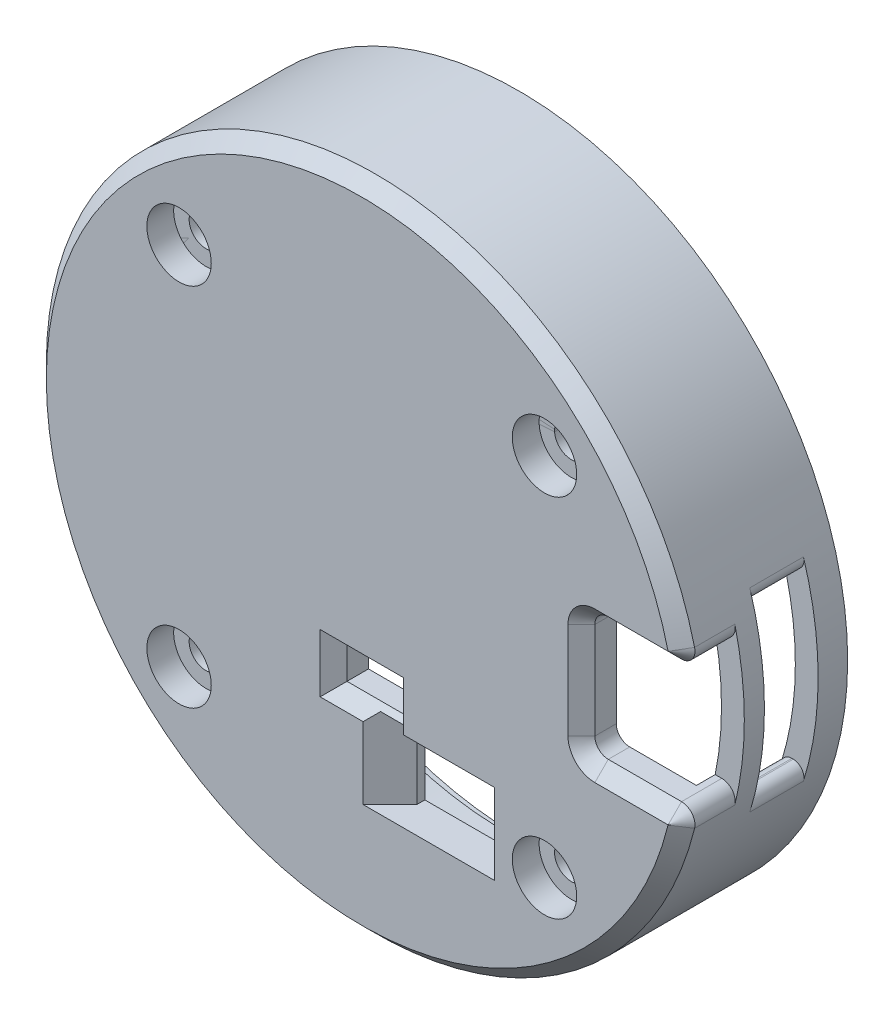
from build123d import *

# Parameters (mm, degrees)
SKETCH_2_R          = 24.5
SKETCH_2_R_2        = 23.6
EXTRUDE_3_DEPTH     = 11.7
SKETCH_2_5_R        = 23.6
SKETCH_2_5_R_2      = 22.8
EXTRUDE_4_DEPTH     = 10.7
SKETCH_2_6_R        = 2.7
SKETCH_2_6_R_2      = 2.3
SKETCH_2_6_W        = 5.8
SKETCH_2_6_H        = 6
SKETCH_2_6_W_2      = 4.2
SKETCH_2_6_H_2      = 2.343935591
EXTRUDE_5_DEPTH     = 2.6
SKETCH_2_7_R        = 2.4
SKETCH_2_7_R_2      = 1.25
EXTRUDE_6_DEPTH     = 4
EXTRUDE_6_2_DEPTH   = 4
EXTRUDE_6_3_DEPTH   = 4
EXTRUDE_6_4_DEPTH   = 4
SKETCH_2_20_R       = 2.3
EXTRUDE_10_DEPTH    = 1.5
SKETCH_2_9_R        = 2.7
SKETCH_2_9_R_2      = 1.25
SKETCH_2_9_R_3      = 2.4
EXTRUDE_7_DEPTH     = 4
CUT_EXTRUDE_2_DEPTH = 9.5
SKETCH_2_18_R       = 2.4
SKETCH_2_18_R_2     = 1.25
CUT_EXTRUDE_3_DEPTH = 2
SKETCH_2_14_R       = 24.5
SKETCH_2_14_R_2     = 22.8
EXTRUDE_9_DEPTH     = 5.5
CUT_EXTRUDE_4_DEPTH = 4
FILLET_2_R          = 0.8
FILLET_3_R          = 0.8
FILLET_4_R          = 0.8
FILLET_5_R          = 0.8
CHAMFER_1_SIZE      = 2
FILLET_6_R          = 1
CHAMFER_5_SIZE      = 1


with BuildPart() as part:
    # 草图2 → 凸台-拉伸3 (new body)
    with BuildSketch(Plane.XY):
        Circle(SKETCH_2_R)
        Circle(SKETCH_2_R_2, mode=Mode.SUBTRACT)
    extrude(amount=-EXTRUDE_3_DEPTH)

    # 草图2<5> → 凸台-拉伸4 (add)
    with BuildSketch(Plane.XY):
        Circle(SKETCH_2_5_R)
        Circle(SKETCH_2_5_R_2, mode=Mode.SUBTRACT)
    extrude(amount=-EXTRUDE_4_DEPTH)

    # 草图2<6> → 凸台-拉伸5 (add)
    with BuildSketch(Plane.XY):
        with BuildLine():
            Line((16.364288895, 4.6), (22.331144171, 4.6))
            ThreePointArc((22.331144171, 4.6), (22.150438226, 5.403525366), (21.940829519, 6.2))
            ThreePointArc((21.940829519, 6.2), (-22.8, 0), (21.940829519, -6.2))
            ThreePointArc((21.940829519, -6.2), (22.150438226, -5.403525366), (22.331144171, -4.6))
            Line((22.331144171, -4.6), (16.364288895, -4.6))
            Line((16.364288895, -4.6), (16.364288895, 4.6))
        make_face()
        with Locations((-13.611805538, -13.611805538)):
            Circle(SKETCH_2_6_R, mode=Mode.SUBTRACT)
        with Locations((-3.326426064, -13.341566236)):
            Circle(SKETCH_2_6_R_2, mode=Mode.SUBTRACT)
        with Locations((5, -12.65)):
            Rectangle(SKETCH_2_6_W, SKETCH_2_6_H, mode=Mode.SUBTRACT)
        with Locations((13.611805538, -13.611805538)):
            Circle(SKETCH_2_6_R, mode=Mode.SUBTRACT)
        with Locations((0, -8.128032205)):
            Rectangle(SKETCH_2_6_W_2, SKETCH_2_6_H_2, mode=Mode.SUBTRACT)
        with Locations((-9.020811649, 10.377256728)):
            Circle(SKETCH_2_6_R_2, mode=Mode.SUBTRACT)
        with Locations((-13.611805538, 13.611805538)):
            Circle(SKETCH_2_6_R, mode=Mode.SUBTRACT)
        with Locations((9.020811649, 10.377256728)):
            Circle(SKETCH_2_6_R_2, mode=Mode.SUBTRACT)
        with Locations((13.611805538, 13.611805538)):
            Circle(SKETCH_2_6_R, mode=Mode.SUBTRACT)
    extrude(amount=-EXTRUDE_5_DEPTH)

    # 草图2<20> → 凸台-拉伸10 (add)
    with BuildSketch(Plane.XY):
        with Locations((-9.020811649, 10.377256728)):
            Circle(SKETCH_2_20_R)
        with Locations((9.020811649, 10.377256728)):
            Circle(SKETCH_2_20_R)
        with Locations((-3.326426064, -13.341566236)):
            Circle(SKETCH_2_20_R)
    extrude(amount=-EXTRUDE_10_DEPTH)

    # 草图2<9> → 凸台-拉伸7 (add)
    # profile 1 of 8: a face of its own
    with BuildSketch(Plane.XY):
        with Locations((-13.611805538, 13.611805538)):
            Circle(SKETCH_2_9_R)
        with Locations((-13.611805538, 13.611805538)):
            Circle(SKETCH_2_9_R_2, mode=Mode.SUBTRACT)
    # profile 2 of 8: a face of its own
    with BuildSketch(Plane.XY):
        with Locations((13.611805538, 13.611805538)):
            Circle(SKETCH_2_9_R)
        with Locations((13.611805538, 13.611805538)):
            Circle(SKETCH_2_9_R_2, mode=Mode.SUBTRACT)
    # profile 3 of 8: a face of its own
    with BuildSketch(Plane.XY):
        with Locations((-13.611805538, 13.611805538)):
            Circle(SKETCH_2_9_R)
        with Locations((-13.611805538, 13.611805538)):
            Circle(SKETCH_2_9_R_3, mode=Mode.SUBTRACT)
    # profile 4 of 8: a face of its own
    with BuildSketch(Plane.XY):
        with Locations((13.611805538, 13.611805538)):
            Circle(SKETCH_2_9_R)
        with Locations((13.611805538, 13.611805538)):
            Circle(SKETCH_2_9_R_3, mode=Mode.SUBTRACT)
    # profile 5 of 8: a face of its own
    with BuildSketch(Plane.XY):
        with Locations((13.611805538, -13.611805538)):
            Circle(SKETCH_2_9_R)
        with Locations((13.611805538, -13.611805538)):
            Circle(SKETCH_2_9_R_3, mode=Mode.SUBTRACT)
    # profile 6 of 8: a face of its own
    with BuildSketch(Plane.XY):
        with Locations((-13.611805538, -13.611805538)):
            Circle(SKETCH_2_9_R)
        with Locations((-13.611805538, -13.611805538)):
            Circle(SKETCH_2_9_R_3, mode=Mode.SUBTRACT)
    # profile 7 of 8: a face of its own
    with BuildSketch(Plane.XY):
        with Locations((-13.611805538, -13.611805538)):
            Circle(SKETCH_2_9_R_3)
        with Locations((-13.611805538, -13.611805538)):
            Circle(SKETCH_2_9_R_2, mode=Mode.SUBTRACT)
    # profile 8 of 8: a face of its own
    with BuildSketch(Plane.XY):
        with Locations((13.611805538, -13.611805538)):
            Circle(SKETCH_2_9_R_3)
        with Locations((13.611805538, -13.611805538)):
            Circle(SKETCH_2_9_R_2, mode=Mode.SUBTRACT)
    extrude(amount=-EXTRUDE_7_DEPTH)

    # 草图2<13> → 切除-拉伸2 (cut)
    with BuildSketch(Plane.XY):
        with BuildLine():
            Line((23.70253151, 6.2), (21.940829519, 6.2))
            ThreePointArc((21.940829519, 6.2), (22.8, 0), (21.940829519, -6.2))
            Line((21.940829519, -6.2), (23.70253151, -6.2))
            ThreePointArc((23.70253151, -6.2), (24.5, 0), (23.70253151, 6.2))
        make_face()
    extrude(amount=-CUT_EXTRUDE_2_DEPTH, mode=Mode.SUBTRACT)


with BuildPart() as body_2:
    # 草图2<7> → 凸台-拉伸6 (new body)
    with BuildSketch(Plane.XY):
        with Locations((13.611805538, 13.611805538)):
            Circle(SKETCH_2_7_R)
        with Locations((13.611805538, 13.611805538)):
            Circle(SKETCH_2_7_R_2, mode=Mode.SUBTRACT)
    extrude(amount=-EXTRUDE_6_DEPTH)


with BuildPart() as body_3:
    # 草图2<7> → Extrude 6 2 (new body)
    with BuildSketch(Plane.XY):
        with Locations((-13.611805538, 13.611805538)):
            Circle(SKETCH_2_7_R)
        with Locations((-13.611805538, 13.611805538)):
            Circle(SKETCH_2_7_R_2, mode=Mode.SUBTRACT)
    extrude(amount=-EXTRUDE_6_2_DEPTH)


with BuildPart() as body_4:
    # 草图2<7> → Extrude 6 3 (new body)
    with BuildSketch(Plane.XY):
        with Locations((13.611805538, -13.611805538)):
            Circle(SKETCH_2_7_R)
        with Locations((13.611805538, -13.611805538)):
            Circle(SKETCH_2_7_R_2, mode=Mode.SUBTRACT)
    extrude(amount=-EXTRUDE_6_3_DEPTH)


with BuildPart() as body_5:
    # 草图2<7> → Extrude 6 4 (new body)
    with BuildSketch(Plane.XY):
        with Locations((-13.611805538, -13.611805538)):
            Circle(SKETCH_2_7_R)
        with Locations((-13.611805538, -13.611805538)):
            Circle(SKETCH_2_7_R_2, mode=Mode.SUBTRACT)
    extrude(amount=-EXTRUDE_6_4_DEPTH)


with BuildPart() as cut_extrude_3_tool:
    # 草图2<18> → 切除-拉伸3 (new body)
    # profile 1 of 4: a face of its own
    with BuildSketch(Plane.XY):
        with Locations((13.611805538, 13.611805538)):
            Circle(SKETCH_2_18_R)
        with Locations((13.611805538, 13.611805538)):
            Circle(SKETCH_2_18_R_2, mode=Mode.SUBTRACT)
    # profile 2 of 4: a face of its own
    with BuildSketch(Plane.XY):
        with Locations((13.611805538, -13.611805538)):
            Circle(SKETCH_2_18_R)
        with Locations((13.611805538, -13.611805538)):
            Circle(SKETCH_2_18_R_2, mode=Mode.SUBTRACT)
    # profile 3 of 4: a face of its own
    with BuildSketch(Plane.XY):
        with Locations((-13.611805538, -13.611805538)):
            Circle(SKETCH_2_18_R)
        with Locations((-13.611805538, -13.611805538)):
            Circle(SKETCH_2_18_R_2, mode=Mode.SUBTRACT)
    # profile 4 of 4: a face of its own
    with BuildSketch(Plane.XY):
        with Locations((-13.611805538, 13.611805538)):
            Circle(SKETCH_2_18_R)
        with Locations((-13.611805538, 13.611805538)):
            Circle(SKETCH_2_18_R_2, mode=Mode.SUBTRACT)
    extrude(amount=-CUT_EXTRUDE_3_DEPTH)


with BuildPart() as part_1:
    add(part.part)

    # 切除-拉伸3: cut by cut_extrude_3_tool
    add(cut_extrude_3_tool.part, mode=Mode.SUBTRACT)

    # 草图2<14> → 凸台-拉伸9 (add)
    with BuildSketch(Plane.XY):
        Circle(SKETCH_2_14_R)
        Circle(SKETCH_2_14_R_2, mode=Mode.SUBTRACT)
    extrude(amount=-EXTRUDE_9_DEPTH)

    # 草图2<19> → 切除-拉伸4 (cut)
    with BuildSketch(Plane.XY):
        with BuildLine():
            ThreePointArc((23.6, 0), (23.486565903, 2.311108411), (23.14735406, 4.6))
            Line((23.14735406, 4.6), (22.331144171, 4.6))
            ThreePointArc((22.331144171, 4.6), (22.682483188, 2.311916185), (22.8, 0))
            ThreePointArc((22.8, 0), (22.682483188, -2.311916185), (22.331144171, -4.6))
            Line((22.331144171, -4.6), (23.14735406, -4.6))
            ThreePointArc((23.14735406, -4.6), (23.486565903, -2.311108411), (23.6, 0))
        make_face()
        with BuildLine():
            ThreePointArc((24.5, 0), (24.390828993, 2.310294579), (24.064288895, 4.6))
            Line((24.064288895, 4.6), (23.14735406, 4.6))
            ThreePointArc((23.14735406, 4.6), (23.486565903, 2.311108411), (23.6, 0))
            ThreePointArc((23.6, 0), (23.486565903, -2.311108411), (23.14735406, -4.6))
            Line((23.14735406, -4.6), (24.064288895, -4.6))
            ThreePointArc((24.064288895, -4.6), (24.390828993, -2.310294579), (24.5, 0))
        make_face()
    extrude(amount=-CUT_EXTRUDE_4_DEPTH, mode=Mode.SUBTRACT)

    # 圆角2
    fillet_2_edges = [part_1.edges().sort_by_distance(p)[0] for p in [
        (23.70253151, 6.2, -7.5),
    ]]
    fillet(fillet_2_edges, radius=FILLET_2_R)

    # 圆角3
    fillet_3_edges = [part_1.edges().sort_by_distance(p)[0] for p in [
        (23.70253151, -6.2, -7.5),
    ]]
    fillet(fillet_3_edges, radius=FILLET_3_R)

    # 圆角4
    fillet_4_edges = [part_1.edges().sort_by_distance(p)[0] for p in [
        (21.940829519, -6.2, -7.5),
    ]]
    fillet(fillet_4_edges, radius=FILLET_4_R)

    # 圆角5
    fillet_5_edges = [part_1.edges().sort_by_distance(p)[0] for p in [
        (21.940829519, 6.2, -7.5),
    ]]
    fillet(fillet_5_edges, radius=FILLET_5_R)

    # 倒角1
    chamfer_1_edges = [part_1.edges().sort_by_distance(p)[0] for p in [
        (2.1, -12.65, 0),
        (7.9, -12.65, 0),
    ]]
    chamfer(chamfer_1_edges, length=CHAMFER_1_SIZE)

    # 倒角4
    # the kernel refuses this chamfer: 1 mm, written as the material it takes off along each edge
    with BuildSketch(Plane(origin=(-2.1, -6.956064409, 0), x_dir=(0, 0.9996219169112968, 0.027495876610586365), z_dir=(1, 0, 0)), Plane(origin=(2.1, -9.3, 0), x_dir=(0, -0.9996219169112968, 0.02749587661058639), z_dir=(-1, 0, 0))) as chamfer_4_piece_1:
        with BuildLine():
            Line((1.028673195, 0), (-0.056547155, -1.027117794))
            Line((-0.056547155, -1.027117794), (-0.076539593, -1.026567876))
            ThreePointArc((-0.076539593, -1.026567876), (-0.034129227, -0.51339783), (-0.019992438, 0.000549918))
            Line((-0.019992438, 0.000549918), (0.000549918, 0.019992438))
            ThreePointArc((0.000549918, 0.019992438), (0.514497665, 0.00585565), (1.029223113, 0.019992438))
            Line((1.029223113, 0.019992438), (1.028673195, 0))
        make_face()
    extrude(amount=4.2, mode=Mode.SUBTRACT)
    with BuildSketch(Plane(origin=(-2.1, -9.3, 0), x_dir=(-0.9996219169112968, 0, 0.027495876610586365), z_dir=(0, 1, 0)), Plane(origin=(2.1, -6.956064409, 0), x_dir=(0.9996219169112968, 0, 0.027495876610586365), z_dir=(0, -1, 0))) as chamfer_4_piece_2:
        with BuildLine():
            Line((1.028673195, 0), (-0.056547155, -1.027117794))
            Line((-0.056547155, -1.027117794), (-0.076539593, -1.026567876))
            ThreePointArc((-0.076539593, -1.026567876), (-0.034129227, -0.51339783), (-0.019992438, 0.000549918))
            Line((-0.019992438, 0.000549918), (0.000549918, 0.019992438))
            ThreePointArc((0.000549918, 0.019992438), (0.514497665, 0.00585565), (1.029223113, 0.019992438))
            Line((1.029223113, 0.019992438), (1.028673195, 0))
        make_face()
    extrude(amount=2.343935591, mode=Mode.SUBTRACT)
    with BuildSketch(Plane(origin=(-2.1, -9.3, 0), x_dir=(-0.9996219169112968, 0, 0.027495876610586365), z_dir=(0, 1, 0))) as chamfer_4_piece_3a_section:
        with BuildLine():
            Line((1.028673195, 0), (-0.056547155, -1.027117794))
            Line((-0.056547155, -1.027117794), (-0.076539593, -1.026567876))
            ThreePointArc((-0.076539593, -1.026567876), (-0.034129227, -0.51339783), (-0.019992438, 0.000549918))
            Line((-0.019992438, 0.000549918), (0.000549918, 0.019992438))
            ThreePointArc((0.000549918, 0.019992438), (0.514497665, 0.00585565), (1.029223113, 0.019992438))
            Line((1.029223113, 0.019992438), (1.028673195, 0))
        make_face()
    chamfer_4_piece_3a = extrude(amount=4.915618579, mode=Mode.PRIVATE)
    chamfer_4_piece_3a = split(chamfer_4_piece_3a, bisect_by=Plane(origin=(-2.429793627, -6.956064409, -0.329793627), z_dir=(0, 1, 0)), keep=Keep.TOP, mode=Mode.PRIVATE)
    with BuildSketch(Plane(origin=(-4.671682988, -6.956064409, 0), x_dir=(0, 0.9996219169112968, 0.027495876610586365), z_dir=(1, 0, 0))) as chamfer_4_piece_3b_section:
        with BuildLine():
            Line((1.028673195, 0), (-0.056547155, -1.027117794))
            Line((-0.056547155, -1.027117794), (-0.076539593, -1.026567876))
            ThreePointArc((-0.076539593, -1.026567876), (-0.034129227, -0.51339783), (-0.019992438, 0.000549918))
            Line((-0.019992438, 0.000549918), (0.000549918, 0.019992438))
            ThreePointArc((0.000549918, 0.019992438), (0.514497665, 0.00585565), (1.029223113, 0.019992438))
            Line((1.029223113, 0.019992438), (1.028673195, 0))
        make_face()
    chamfer_4_piece_3b = extrude(amount=6.771682988, mode=Mode.PRIVATE)
    chamfer_4_piece_3b = split(chamfer_4_piece_3b, bisect_by=Plane(origin=(-2.1, -6.626270782, -0.329793627), z_dir=(-1, 0, 0)), keep=Keep.TOP, mode=Mode.PRIVATE)
    chamfer_4_piece_3 = chamfer_4_piece_3a & chamfer_4_piece_3b
    add(chamfer_4_piece_3, mode=Mode.SUBTRACT)
    with BuildSketch(Plane(origin=(-2.1, -6.956064409, 0), x_dir=(0, 0.9996219169112968, 0.027495876610586365), z_dir=(1, 0, 0))) as chamfer_4_piece_4a_section:
        with BuildLine():
            Line((1.028673195, 0), (-0.056547155, -1.027117794))
            Line((-0.056547155, -1.027117794), (-0.076539593, -1.026567876))
            ThreePointArc((-0.076539593, -1.026567876), (-0.034129227, -0.51339783), (-0.019992438, 0.000549918))
            Line((-0.019992438, 0.000549918), (0.000549918, 0.019992438))
            ThreePointArc((0.000549918, 0.019992438), (0.514497665, 0.00585565), (1.029223113, 0.019992438))
            Line((1.029223113, 0.019992438), (1.028673195, 0))
        make_face()
    chamfer_4_piece_4a = extrude(amount=6.771682988, mode=Mode.PRIVATE)
    chamfer_4_piece_4a = split(chamfer_4_piece_4a, bisect_by=Plane(origin=(2.1, -6.626270782, -0.329793627), z_dir=(1, 0, 0)), keep=Keep.TOP, mode=Mode.PRIVATE)
    with BuildSketch(Plane(origin=(2.1, -4.384381421, 0), x_dir=(0.9996219169112968, 0, 0.027495876610586365), z_dir=(0, -1, 0))) as chamfer_4_piece_4b_section:
        with BuildLine():
            Line((1.028673195, 0), (-0.056547155, -1.027117794))
            Line((-0.056547155, -1.027117794), (-0.076539593, -1.026567876))
            ThreePointArc((-0.076539593, -1.026567876), (-0.034129227, -0.51339783), (-0.019992438, 0.000549918))
            Line((-0.019992438, 0.000549918), (0.000549918, 0.019992438))
            ThreePointArc((0.000549918, 0.019992438), (0.514497665, 0.00585565), (1.029223113, 0.019992438))
            Line((1.029223113, 0.019992438), (1.028673195, 0))
        make_face()
    chamfer_4_piece_4b = extrude(amount=4.915618579, mode=Mode.PRIVATE)
    chamfer_4_piece_4b = split(chamfer_4_piece_4b, bisect_by=Plane(origin=(2.429793627, -6.956064409, -0.329793627), z_dir=(0, 1, 0)), keep=Keep.TOP, mode=Mode.PRIVATE)
    chamfer_4_piece_4 = chamfer_4_piece_4a & chamfer_4_piece_4b
    add(chamfer_4_piece_4, mode=Mode.SUBTRACT)
    with BuildSketch(Plane(origin=(-2.1, -11.871682988, 0), x_dir=(-0.9996219169112968, 0, 0.027495876610586365), z_dir=(0, 1, 0))) as chamfer_4_piece_5a_section:
        with BuildLine():
            Line((1.028673195, 0), (-0.056547155, -1.027117794))
            Line((-0.056547155, -1.027117794), (-0.076539593, -1.026567876))
            ThreePointArc((-0.076539593, -1.026567876), (-0.034129227, -0.51339783), (-0.019992438, 0.000549918))
            Line((-0.019992438, 0.000549918), (0.000549918, 0.019992438))
            ThreePointArc((0.000549918, 0.019992438), (0.514497665, 0.00585565), (1.029223113, 0.019992438))
            Line((1.029223113, 0.019992438), (1.028673195, 0))
        make_face()
    chamfer_4_piece_5a = extrude(amount=4.915618579, mode=Mode.PRIVATE)
    chamfer_4_piece_5a = split(chamfer_4_piece_5a, bisect_by=Plane(origin=(-2.429793627, -9.3, -0.329793627), z_dir=(0, -1, 0)), keep=Keep.TOP, mode=Mode.PRIVATE)
    with BuildSketch(Plane(origin=(2.1, -9.3, 0), x_dir=(0, -0.9996219169112968, 0.02749587661058639), z_dir=(-1, 0, 0))) as chamfer_4_piece_5b_section:
        with BuildLine():
            Line((1.028673195, 0), (-0.056547155, -1.027117794))
            Line((-0.056547155, -1.027117794), (-0.076539593, -1.026567876))
            ThreePointArc((-0.076539593, -1.026567876), (-0.034129227, -0.51339783), (-0.019992438, 0.000549918))
            Line((-0.019992438, 0.000549918), (0.000549918, 0.019992438))
            ThreePointArc((0.000549918, 0.019992438), (0.514497665, 0.00585565), (1.029223113, 0.019992438))
            Line((1.029223113, 0.019992438), (1.028673195, 0))
        make_face()
    chamfer_4_piece_5b = extrude(amount=6.771682988, mode=Mode.PRIVATE)
    chamfer_4_piece_5b = split(chamfer_4_piece_5b, bisect_by=Plane(origin=(-2.1, -9.629793627, -0.329793627), z_dir=(-1, 0, 0)), keep=Keep.TOP, mode=Mode.PRIVATE)
    chamfer_4_piece_5 = chamfer_4_piece_5a & chamfer_4_piece_5b
    add(chamfer_4_piece_5, mode=Mode.SUBTRACT)
    with BuildSketch(Plane(origin=(2.1, -6.956064409, 0), x_dir=(0.9996219169112968, 0, 0.027495876610586365), z_dir=(0, -1, 0))) as chamfer_4_piece_6a_section:
        with BuildLine():
            Line((1.028673195, 0), (-0.056547155, -1.027117794))
            Line((-0.056547155, -1.027117794), (-0.076539593, -1.026567876))
            ThreePointArc((-0.076539593, -1.026567876), (-0.034129227, -0.51339783), (-0.019992438, 0.000549918))
            Line((-0.019992438, 0.000549918), (0.000549918, 0.019992438))
            ThreePointArc((0.000549918, 0.019992438), (0.514497665, 0.00585565), (1.029223113, 0.019992438))
            Line((1.029223113, 0.019992438), (1.028673195, 0))
        make_face()
    chamfer_4_piece_6a = extrude(amount=4.915618579, mode=Mode.PRIVATE)
    chamfer_4_piece_6a = split(chamfer_4_piece_6a, bisect_by=Plane(origin=(2.429793627, -9.3, -0.329793627), z_dir=(0, -1, 0)), keep=Keep.TOP, mode=Mode.PRIVATE)
    with BuildSketch(Plane(origin=(4.671682988, -9.3, 0), x_dir=(0, -0.9996219169112968, 0.02749587661058639), z_dir=(-1, 0, 0))) as chamfer_4_piece_6b_section:
        with BuildLine():
            Line((1.028673195, 0), (-0.056547155, -1.027117794))
            Line((-0.056547155, -1.027117794), (-0.076539593, -1.026567876))
            ThreePointArc((-0.076539593, -1.026567876), (-0.034129227, -0.51339783), (-0.019992438, 0.000549918))
            Line((-0.019992438, 0.000549918), (0.000549918, 0.019992438))
            ThreePointArc((0.000549918, 0.019992438), (0.514497665, 0.00585565), (1.029223113, 0.019992438))
            Line((1.029223113, 0.019992438), (1.028673195, 0))
        make_face()
    chamfer_4_piece_6b = extrude(amount=6.771682988, mode=Mode.PRIVATE)
    chamfer_4_piece_6b = split(chamfer_4_piece_6b, bisect_by=Plane(origin=(2.1, -9.629793627, -0.329793627), z_dir=(1, 0, 0)), keep=Keep.TOP, mode=Mode.PRIVATE)
    chamfer_4_piece_6 = chamfer_4_piece_6a & chamfer_4_piece_6b
    add(chamfer_4_piece_6, mode=Mode.SUBTRACT)

    # 圆角6
    fillet_6_edges = [part_1.edges().sort_by_distance(p)[0] for p in [
        (24.064288895, 4.6, -2),
        (24.064288895, -4.6, -2),
        (16.364288895, 4.6, -1.3),
        (16.364288895, -4.6, -1.3),
    ]]
    fillet(fillet_6_edges, radius=FILLET_6_R)

    # 倒角5
    chamfer_5_edges = [part_1.edges().sort_by_distance(p)[0] for p in [
        (20.093651797, 4.6, 0),
        (-24.5, 0, 0),
        (20.093651797, -4.6, 0),
        (16.364288895, 0, 0),
        (23.609874876, -4.982868682, 0),
        (23.609874876, 4.982868682, 0),
        (16.657182113, 4.307106781, 0),
        (16.657182113, -4.307106781, 0),
    ]]
    chamfer(chamfer_5_edges, length=CHAMFER_5_SIZE)


with BuildPart() as body_2_1:
    add(body_2.part)

    # 切除-拉伸3: cut by cut_extrude_3_tool
    add(cut_extrude_3_tool.part, mode=Mode.SUBTRACT)


with BuildPart() as body_3_1:
    add(body_3.part)

    # 切除-拉伸3: cut by cut_extrude_3_tool
    add(cut_extrude_3_tool.part, mode=Mode.SUBTRACT)


with BuildPart() as body_4_1:
    add(body_4.part)

    # 切除-拉伸3: cut by cut_extrude_3_tool
    add(cut_extrude_3_tool.part, mode=Mode.SUBTRACT)


with BuildPart() as body_5_1:
    add(body_5.part)

    # 切除-拉伸3: cut by cut_extrude_3_tool
    add(cut_extrude_3_tool.part, mode=Mode.SUBTRACT)


solid = Compound([part_1.part, body_2_1.part, body_3_1.part, body_4_1.part, body_5_1.part])
